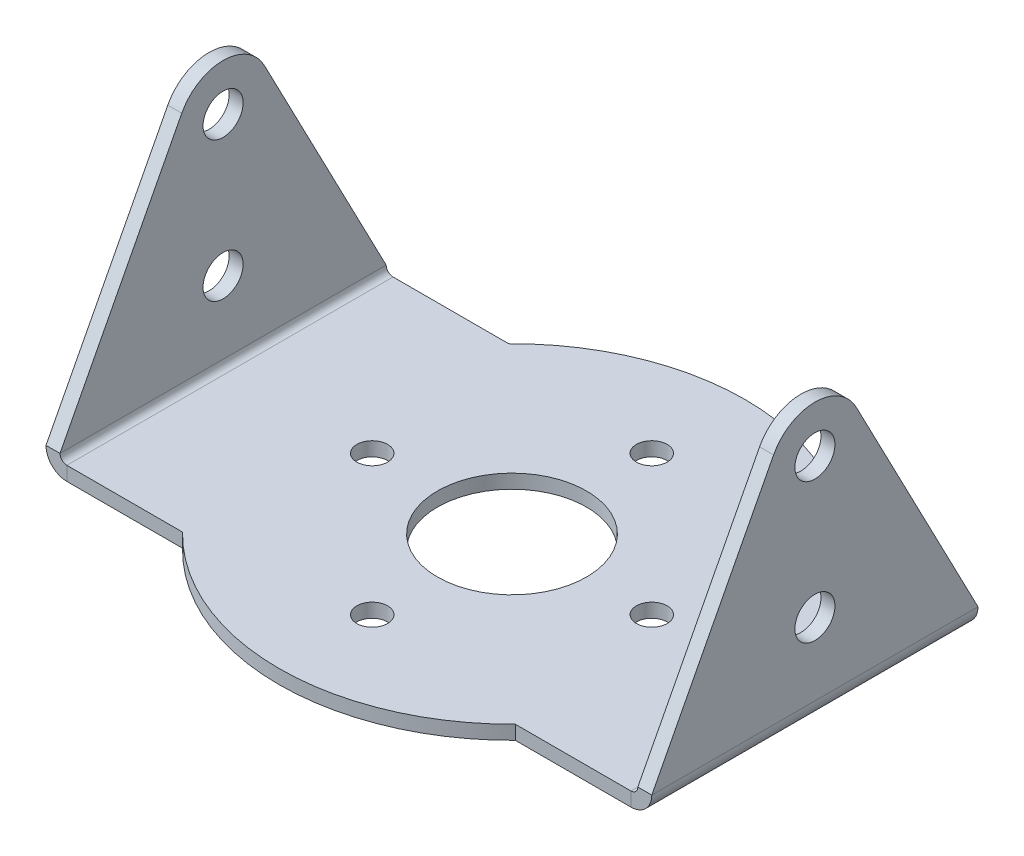
from build123d import *

# Parameters (mm, degrees)
SKETCH_6_R                         = 8
SKETCH_6_R_2                       = 1.65
SM_BASE_FLANGE_2_DEPTH             = 1.5
SM_EDGE_FLANGE_1_STRIP_W           = 7.4732
SM_EDGE_FLANGE_1_STRIP_H           = 1.5
SM_EDGE_FLANGE_1_STRIP_CUT_DEPTH   = 35
SM_EDGE_FLANGE_1_STRIP_2_W         = 7.4732
SM_EDGE_FLANGE_1_STRIP_2_H         = 1.5
SM_EDGE_FLANGE_1_STRIP_CUT_2_DEPTH = 35
SM_EDGE_FLANGE_1_DEPTH             = 35
SM_EDGE_FLANGE_1_BEND_DEPTH        = 35
CUT_EXTRUDE_1_DEPTH                = 76.828754441


# Sheet-metal steps are written as plain solids
with BuildPart() as part:
    # 草图6 → 基体-法兰2 (new body)
    with BuildSketch(Plane(origin=(0, 0, 0), x_dir=(1, 0, 0), z_dir=(0, 1, 0))):
        with BuildLine():
            Line((17.853571071, -17.5), (32.5, -17.5))
            Line((32.5, -17.5), (32.5, 17.5))
            Line((32.5, 17.5), (17.853571071, 17.5))
            ThreePointArc((17.853571071, 17.5), (0, 25), (-17.853571071, 17.5))
            Line((-17.853571071, 17.5), (-32.5, 17.5))
            Line((-32.5, 17.5), (-32.5, -17.5))
            Line((-32.5, -17.5), (-17.853571071, -17.5))
            ThreePointArc((-17.853571071, -17.5), (0, -25), (17.853571071, -17.5))
        make_face()
        with Locations(Location((0, 0, 0), (0, 0, 270))):
            Circle(SKETCH_6_R, mode=Mode.SUBTRACT)
        with Locations(Location((0, 15, 0), (0, 0, 270))):
            Circle(SKETCH_6_R_2, mode=Mode.SUBTRACT)
        with Locations(Location((-15, 0, 0), (0, 0, 270))):
            Circle(SKETCH_6_R_2, mode=Mode.SUBTRACT)
        with Locations(Location((0, -15, 0), (0, 0, 270))):
            Circle(SKETCH_6_R_2, mode=Mode.SUBTRACT)
        with Locations(Location((15, 0, 0), (0, 0, 270))):
            Circle(SKETCH_6_R_2, mode=Mode.SUBTRACT)
    extrude(amount=SM_BASE_FLANGE_2_DEPTH)

    # 边线-法兰1 strip (across the edge) → 边线-法兰1 strip cut (cut)
    with BuildSketch(Plane(origin=(-32.5, 1.5, -17.5), x_dir=(1, 0, 0), z_dir=(0, 0, 1))):
        with Locations((-1.5, -0.75)):
            Rectangle(SM_EDGE_FLANGE_1_STRIP_W, SM_EDGE_FLANGE_1_STRIP_H)
    extrude(amount=SM_EDGE_FLANGE_1_STRIP_CUT_DEPTH, mode=Mode.SUBTRACT)

    # 边线-法兰1 strip 2 (across the edge) → 边线-法兰1 strip cut 2 (cut)
    with BuildSketch(Plane(origin=(32.5, 1.5, 17.5), x_dir=(-1, 0, 0), z_dir=(0, 0, -1))):
        with Locations((-1.5, -0.75)):
            Rectangle(SM_EDGE_FLANGE_1_STRIP_2_W, SM_EDGE_FLANGE_1_STRIP_2_H)
    extrude(amount=SM_EDGE_FLANGE_1_STRIP_CUT_2_DEPTH, mode=Mode.SUBTRACT)

    # 边线-法兰1 section (across the edge) → 边线-法兰1 (add)
    with BuildSketch(Plane(origin=(-32.5, 1.5, -17.5), x_dir=(1, 0, 0), z_dir=(0, 0, 1))):
        with BuildLine():
            Line((0, 0.7366), (0, 28.5))
            Line((0, 28.5), (1.5, 28.5))
            Line((1.5, 28.5), (1.5, 0.7366))
            ThreePointArc((1.5, 0.7366), (1.715745145, 0.215745145), (2.2366, 0))
            Line((2.2366, 0), (2.2366, -1.5))
            ThreePointArc((2.2366, -1.5), (0.655084973, -0.844915027), (0, 0.7366))
        make_face()
    extrude(amount=SM_EDGE_FLANGE_1_DEPTH)

    # 边线-法兰1 section 2 (across the edge) → 边线-法兰1 bend (add)
    with BuildSketch(Plane(origin=(32.5, 1.5, 17.5), x_dir=(-1, 0, 0), z_dir=(0, 0, -1))):
        with BuildLine():
            Line((0, 0.7366), (0, 28.5))
            Line((0, 28.5), (1.5, 28.5))
            Line((1.5, 28.5), (1.5, 0.7366))
            ThreePointArc((1.5, 0.7366), (1.715745145, 0.215745145), (2.2366, 0))
            Line((2.2366, 0), (2.2366, -1.5))
            ThreePointArc((2.2366, -1.5), (0.655084973, -0.844915027), (0, 0.7366))
        make_face()
    extrude(amount=SM_EDGE_FLANGE_1_BEND_DEPTH)

    # 草图18 → 切除-拉伸1 (cut, through all)
    with BuildSketch(Plane(origin=(32.5, 0, 0), x_dir=(0, 0, -1), z_dir=(1, 0, 0))):
        with BuildLine():
            Line((-17.5, 30), (-17.5, 2.2366))
            Line((-17.5, 2.2366), (-4.434096645, 27.310581516))
            ThreePointArc((-4.434096645, 27.310581516), (-2.592980179, 29.275096933), (0, 30))
            Line((0, 30), (-17.5, 30))
        make_face()
        with BuildLine():
            Line((17.5, 30), (0, 30))
            ThreePointArc((0, 30), (2.592980179, 29.275096933), (4.434096645, 27.310581516))
            Line((4.434096645, 27.310581516), (17.5, 2.2366))
            Line((17.5, 2.2366), (17.5, 30))
        make_face()
        with BuildLine():
            ThreePointArc((2.15, 25), (1.52027958, 26.52027958), (0, 27.15))
            Line((0, 27.15), (0, 22.85))
            ThreePointArc((0, 22.85), (1.52027958, 23.47972042), (2.15, 25))
        make_face()
        with BuildLine():
            Line((0, 22.85), (0, 27.15))
            ThreePointArc((0, 27.15), (-2.15, 25), (0, 22.85))
        make_face()
        with BuildLine():
            ThreePointArc((2.15, 10), (1.52027958, 11.52027958), (0, 12.15))
            Line((0, 12.15), (0, 7.85))
            ThreePointArc((0, 7.85), (1.52027958, 8.47972042), (2.15, 10))
        make_face()
        with BuildLine():
            Line((0, 7.85), (0, 12.15))
            ThreePointArc((0, 12.15), (-2.15, 10), (0, 7.85))
        make_face()
    extrude(amount=-CUT_EXTRUDE_1_DEPTH, mode=Mode.SUBTRACT)


solid = part.part
